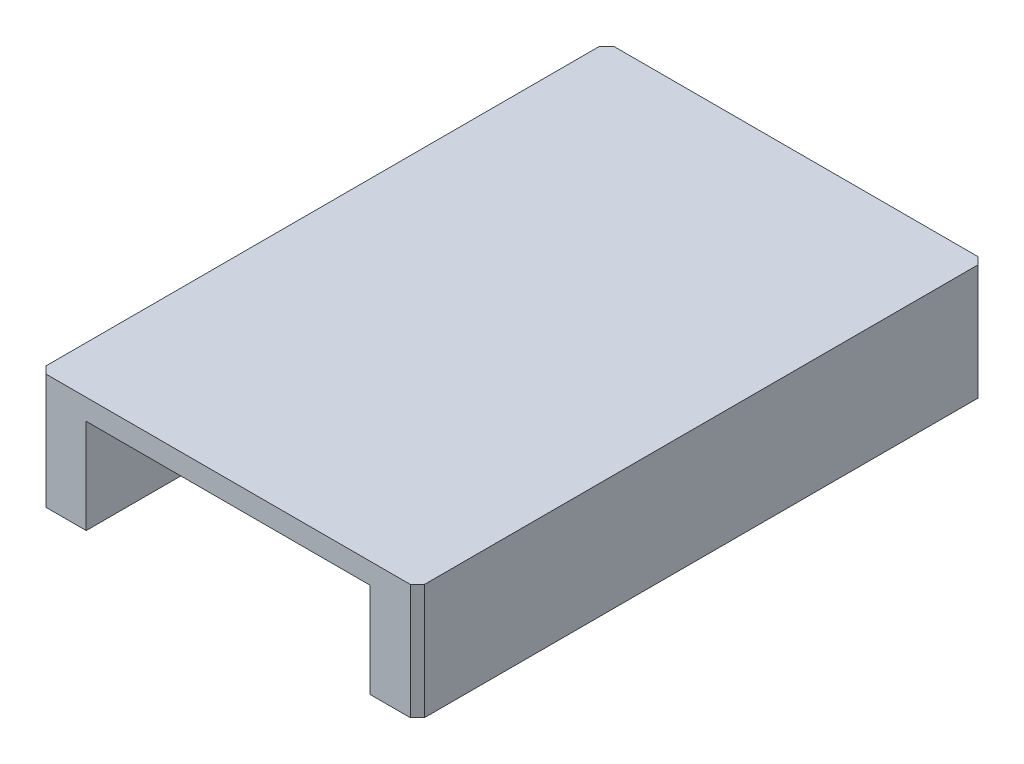
from build123d import *

# Parameters (mm, degrees)
SCHIZZO1_W                        = 60
SCHIZZO1_H                        = 7.2
SCHIZZO1_W_2                      = 19.125
SCHIZZO1_H_2                      = 5
ESTRUSIONE_ESTRUSIONE1_DEPTH      = 40
SCHIZZO2_W                        = 11.375
SCHIZZO2_H                        = 5
SCHIZZO2_W_2                      = 2.075
SCHIZZO2_H_2                      = 1.1
SCHIZZO2_W_3                      = 2.05
TAGLIO_ESTRUSIONE1_DEPTH          = 73.469579825
SMUSSO1_SIZE                      = 0.75
SCHIZZO3_W                        = 7.25
SCHIZZO3_H                        = 5
TAGLIO_ESTRUSIONE2_DEPTH          = 64
SCHIZZO4_W                        = 38.5
SCHIZZO4_H                        = 1.1
ESTRUSIONE_ESTRUSIONE3_DEPTH      = 60
SCHIZZO7_W                        = 30
SCHIZZO7_H                        = 1.1
ESTRUSIONE_ESTRUSIONE4_DEPTH      = 50
ESTRUSIONE_ESTRUSIONE5_DEPTH      = 5
ESTRUSIONE_ESTRUSIONE6_DEPTH      = 5
ESTRUSIONE_ESTRUSIONE6_DEPTH_BACK = 35
SCHIZZO9_W                        = 19.125
SCHIZZO9_H                        = 1.1
SCHIZZO10_W                       = 19.125
SCHIZZO10_H                       = 3.9
TAGLIO_ESTRUSIONE3_DEPTH          = 73.469579825
SCHIZZO12_W                       = 19.125
SCHIZZO12_H                       = 7.8
ESTRUSIONE_ESTRUSIONE7_DEPTH      = 40
SCHIZZO13_W                       = 30
SCHIZZO13_H                       = 10
TAGLIO_ESTRUSIONE4_DEPTH          = 66


with BuildPart() as part:
    # Schizzo1 → Estrusione-Estrusione1 (new body)
    with BuildSketch(Plane(origin=(0, 0, 0), x_dir=(0, 0, -1), z_dir=(1, 0, 0))):
        with Locations((30, 3.6)):
            Rectangle(SCHIZZO1_W, SCHIZZO1_H)
        with Locations((43.1875, 3.6)):
            Rectangle(SCHIZZO1_W_2, SCHIZZO1_H_2, mode=Mode.SUBTRACT)
        with Locations((16.8125, 3.6)):
            Rectangle(SCHIZZO1_W_2, SCHIZZO1_H_2, mode=Mode.SUBTRACT)
    extrude(amount=ESTRUSIONE_ESTRUSIONE1_DEPTH)

    # Schizzo2 → Taglio-Estrusione1 (cut, through all)
    with BuildSketch(Plane.XY):
        with Locations((10.6875, 2.5)):
            Rectangle(SCHIZZO2_W, SCHIZZO2_H)
        with Locations((29.3125, 2.5)):
            Rectangle(SCHIZZO2_W, SCHIZZO2_H)
        with Locations((15.3375, 6.65)):
            Rectangle(SCHIZZO2_W_2, SCHIZZO2_H_2)
        with Locations((8.275, 6.65)):
            Rectangle(SCHIZZO2_W_3, SCHIZZO2_H_2)
        with Locations((24.6625, 6.65)):
            Rectangle(SCHIZZO2_W_2, SCHIZZO2_H_2)
        with Locations((31.725, 6.65)):
            Rectangle(SCHIZZO2_W_3, SCHIZZO2_H_2)
    extrude(amount=-TAGLIO_ESTRUSIONE1_DEPTH, mode=Mode.SUBTRACT)

    # Smusso1
    smusso1_edges = [part.edges().sort_by_distance(p)[0] for p in [
        (0, 3.6, -60),
        (40, 3.6, -60),
        (40, 3.6, 0),
        (0, 3.6, 0),
    ]]
    chamfer(smusso1_edges, length=SMUSSO1_SIZE)

    # Schizzo3 → Taglio-Estrusione2 (cut)
    with BuildSketch(Plane.XY):
        with Locations((20, 2.5)):
            Rectangle(SCHIZZO3_W, SCHIZZO3_H)
    extrude(amount=-TAGLIO_ESTRUSIONE2_DEPTH, mode=Mode.SUBTRACT)

    # Schizzo4 → Estrusione-Estrusione3 (add)
    with BuildSketch(Plane.XY):
        with Locations((20, 6.65)):
            Rectangle(SCHIZZO4_W, SCHIZZO4_H)
    extrude(amount=-ESTRUSIONE_ESTRUSIONE3_DEPTH)

    # Schizzo7 → Estrusione-Estrusione4 (add)
    with BuildSketch(Plane.XY.offset(-52.75)):
        with Locations((20, 5.55)):
            Rectangle(SCHIZZO7_W, SCHIZZO7_H)
    extrude(amount=ESTRUSIONE_ESTRUSIONE4_DEPTH)

    # Schizzo8 → Estrusione-Estrusione5 (add)
    with BuildSketch(Plane.XZ):
        Polygon((5, 0), (0.75, 0), (0, -0.75), (0, -59.25), (0.75, -60), (5, -60), align=None)
        Polygon((35, 0), (35, -60), (39.25, -60), (40, -59.25), (40, -0.75), (39.25, 0), align=None)
    extrude(amount=ESTRUSIONE_ESTRUSIONE5_DEPTH)

    # Schizzo9 → Estrusione-Estrusione6 (add, two sides: drawn at the far end of the back side and taken through both)
    with BuildSketch(Plane(origin=(35, 0, 0), x_dir=(0, 0, -1), z_dir=(1, 0, 0)).offset(-ESTRUSIONE_ESTRUSIONE6_DEPTH_BACK)):
        with Locations((16.8125, 5.55)):
            Rectangle(SCHIZZO9_W, SCHIZZO9_H)
        with Locations((43.1875, 5.55)):
            Rectangle(SCHIZZO9_W, SCHIZZO9_H)
    extrude(amount=ESTRUSIONE_ESTRUSIONE6_DEPTH + ESTRUSIONE_ESTRUSIONE6_DEPTH_BACK)

    # Schizzo10 → Taglio-Estrusione3 (cut, through all)
    with BuildSketch(Plane.ZY):
        with Locations((-43.1875, -0.85)):
            Rectangle(SCHIZZO10_W, SCHIZZO10_H)
        with Locations((-16.8125, -0.85)):
            Rectangle(SCHIZZO10_W, SCHIZZO10_H)
    extrude(amount=-TAGLIO_ESTRUSIONE3_DEPTH, mode=Mode.SUBTRACT)

    # Schizzo12 → Estrusione-Estrusione7 (add)
    with BuildSketch(Plane(origin=(40, 0, 0), x_dir=(0, 0, -1), z_dir=(1, 0, 0))):
        with Locations((16.8125, 1.1)):
            Rectangle(SCHIZZO12_W, SCHIZZO12_H)
        with Locations((43.1875, 1.1)):
            Rectangle(SCHIZZO12_W, SCHIZZO12_H)
    extrude(amount=-ESTRUSIONE_ESTRUSIONE7_DEPTH)

    # Schizzo13 → Taglio-Estrusione4 (cut)
    with BuildSketch(Plane.XY.offset(-7.25)):
        with Locations((20, 0)):
            Rectangle(SCHIZZO13_W, SCHIZZO13_H)
    extrude(amount=-TAGLIO_ESTRUSIONE4_DEPTH, mode=Mode.SUBTRACT)


solid = part.part
